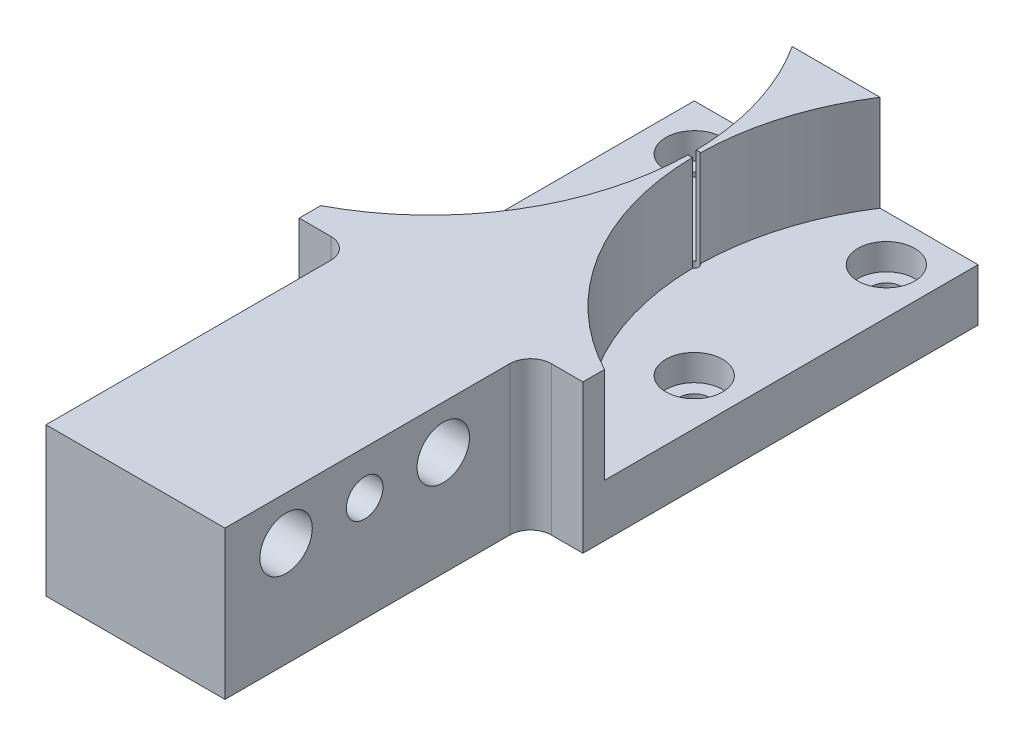
from build123d import *

# Parameters (mm, degrees)
SKETCH1_W                      = 32.5
SKETCH1_H                      = 80.25
BOSS_EXTRUDE1_DEPTH            = 6
BOSS_EXTRUDE2_DEPTH            = 11
F_6_0MM_DOWEL_HOLE1_D          = 6
M5X0_8_TAPPED_HOLE1_D          = 4.2
CBORE_FOR_M3_SHCS1_D           = 3.4
CBORE_FOR_M3_SHCS1_CBORE_D     = 6.5
CBORE_FOR_M3_SHCS1_CBORE_DEPTH = 3
F_1_0_1_DIAMETER_HOLE1_D       = 1
SKETCH12_R                     = 1.5
CUT_EXTRUDE1_DEPTH             = 5
SKETCH13_W                     = 6
SKETCH13_H                     = 35
CUT_EXTRUDE2_DEPTH             = 84.624906577
FILLET1_R                      = 2.38125


with BuildPart() as part:
    # Sketch1 → Boss-Extrude1 (new body)
    with BuildSketch(Plane(origin=(0, 0, 0), x_dir=(1, 0, 0), z_dir=(0, 1, 0))):
        with Locations((0, -40.125)):
            Rectangle(SKETCH1_W, SKETCH1_H)
    extrude(amount=-BOSS_EXTRUDE1_DEPTH)

    # Sketch2 → Boss-Extrude2 (add)
    with BuildSketch(Plane(origin=(0, 0, 0), x_dir=(1, 0, 0), z_dir=(0, 1, 0))):
        with BuildLine():
            Line((-5.032198748, 0), (5.032198748, 0))
            ThreePointArc((5.032198748, 0), (1.230950737, -23.858861929), (16.25, -42.782998323))
            Line((16.25, -42.782998323), (16.25, -80.25))
            Line((16.25, -80.25), (-16.25, -80.25))
            Line((-16.25, -80.25), (-16.25, -42.782998323))
            ThreePointArc((-16.25, -42.782998323), (-1.230950737, -23.858861929), (-5.032198748, 0))
        make_face()
    extrude(amount=BOSS_EXTRUDE2_DEPTH)

    # Ø6.0mm Dowel Hole1 (through all)
    with Locations(Plane(origin=(16.25, 0, 0), x_dir=(0, 0, -1), z_dir=(1, 0, 0))):
        with Locations((-73.25, 6), (-55.25, 6)):
            Hole(F_6_0MM_DOWEL_HOLE1_D / 2)

    # M5x0.8 Tapped Hole1 (through all)
    with Locations(Plane(origin=(16.25, 0, 0), x_dir=(0, 0, -1), z_dir=(1, 0, 0))):
        with Locations((-64.25, 6)):
            Hole(M5X0_8_TAPPED_HOLE1_D / 2)

    # CBORE for M3 SHCS1 (through all)
    with Locations(Plane(origin=(0, 0, 0), x_dir=(1, 0, 0), z_dir=(0, 1, 0))):
        with Locations((-11, -5.25), (11, -5.25), (11, -27.25), (-11, -27.25)):
            CounterBoreHole(CBORE_FOR_M3_SHCS1_D / 2, CBORE_FOR_M3_SHCS1_CBORE_D / 2, CBORE_FOR_M3_SHCS1_CBORE_DEPTH)

    # Ø1.0 (1) Diameter Hole1 (through all)
    with Locations(Plane(origin=(0, 11, 0), x_dir=(1, 0, 0), z_dir=(0, 1, 0))):
        with Locations((0, -16.25)):
            Hole(F_1_0_1_DIAMETER_HOLE1_D / 2)

    # Sketch12 → Cut-Extrude1 (cut)
    with BuildSketch(Plane.XZ.offset(6)):
        with Locations((0, 16.25)):
            Circle(SKETCH12_R)
    extrude(amount=-CUT_EXTRUDE1_DEPTH, mode=Mode.SUBTRACT)

    # Sketch13 → Cut-Extrude2 (cut, through all)
    with BuildSketch(Plane(origin=(0, 11, 0), x_dir=(1, 0, 0), z_dir=(0, 1, 0))):
        with Locations((-13.25, -62.75)):
            Rectangle(SKETCH13_W, SKETCH13_H)
        with Locations((13.25, -62.75)):
            Rectangle(SKETCH13_W, SKETCH13_H)
    extrude(amount=-CUT_EXTRUDE2_DEPTH, mode=Mode.SUBTRACT)

    # Fillet1
    fillet1_edges = [part.edges().sort_by_distance(p)[0] for p in [
        (10.25, 2.5, 45.25),
        (-10.25, 2.5, 45.25),
    ]]
    fillet(fillet1_edges, radius=FILLET1_R)


solid = part.part
